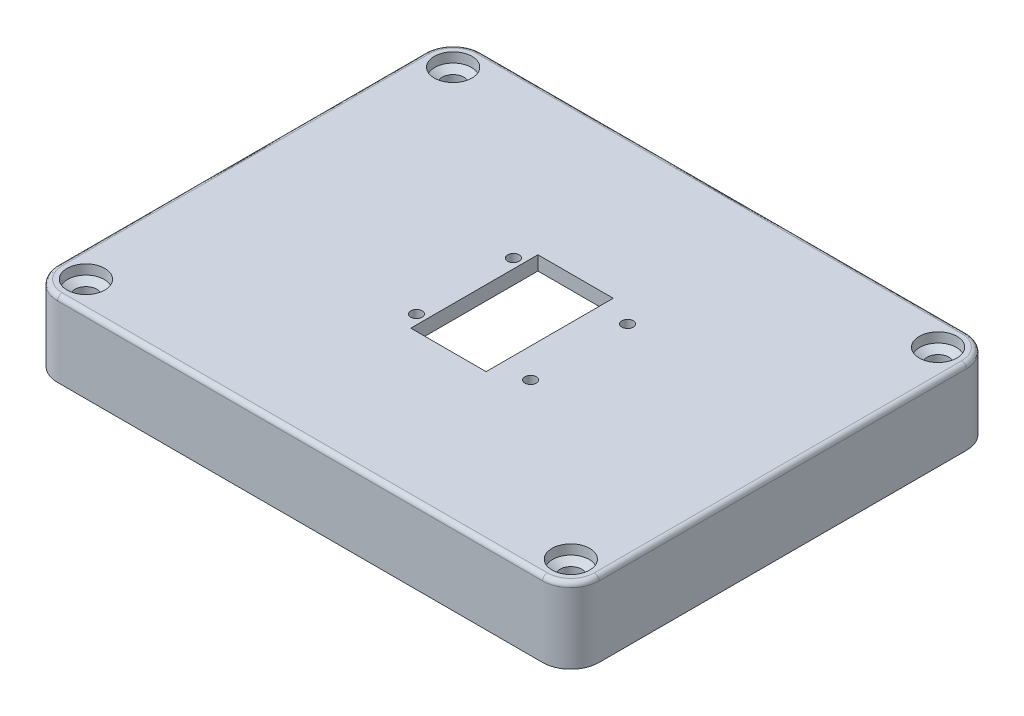
from build123d import *

# Parameters (mm, degrees)
CUTPROFILES_W             = 2
CUTPROFILES_H             = 3
SRQPVM_COPY_1_SKETCH_W    = 2
SRQPVM_COPY_1_SKETCH_H    = 3
CBFASTENINGHOLEBOTTOMS_R  = 2.2
CBFASTENINGHOLETOPS_R     = 2.35
CORNERBODYPOCKETCUT_DEPTH = 13
CORNERBODYSIDEHOLES_R     = 1
CORNERBODYSIDEHOLE_DEPTH  = 12
CBPCVM_COPY_1_DEPTH       = 13
CBPCVM_COPY_2_SKETCH_R    = 1
CBPCVM_COPY_2_DEPTH       = 12
TOPBODYFILLET_R           = 1
SCHIZZO1_R                = 1.2
SCHIZZO1_W                = 16
SCHIZZO1_H                = 27
TAGLIO_ESTRUSIONE1_DEPTH  = 10


# Read off the part's stored shape, not the designer's step: CBHM, CBFHHM
with BuildPart() as part:
    # BottomBaseS for Body → Body section 0
    with BuildSketch(Plane(origin=(0, -16, 0), x_dir=(1, 0, 0), z_dir=(0, 1, 0))):
        with BuildLine():
            Line((-51.5, 45), (51.5, 45))
            # circular arc as an exact rational Bezier (weights 1, cos(half-angle), 1)
            Bezier((51.5, 45), (57.5, 45), (57.5, 39), weights=[1, 0.707106781, 1])
            Line((57.5, 39), (57.5, -39))
            Bezier((57.5, -39), (57.5, -45), (51.5, -45), weights=[1, 0.707106781, 1])
            Line((51.5, -45), (-51.5, -45))
            Bezier((-51.5, -45), (-57.5, -45), (-57.5, -39), weights=[1, 0.707106781, 1])
            Line((-57.5, -39), (-57.5, 39))
            Bezier((-57.5, 39), (-57.5, 45), (-51.5, 45), weights=[1, 0.707106781, 1])
        make_face()
    # TopBaseS for Body → Body section 1
    with BuildSketch(Plane(origin=(0, 0, 0), x_dir=(1, 0, 0), z_dir=(0, 1, 0))):
        with BuildLine():
            Line((-51.5, -45), (51.5, -45))
            Bezier((51.5, -45), (57.5, -45), (57.5, -39), weights=[1, 0.707106781, 1])
            Line((57.5, -39), (57.5, 39))
            Bezier((57.5, 39), (57.5, 45), (51.5, 45), weights=[1, 0.707106781, 1])
            Line((51.5, 45), (-51.5, 45))
            Bezier((-51.5, 45), (-57.5, 45), (-57.5, 39), weights=[1, 0.707106781, 1])
            Line((-57.5, 39), (-57.5, -39))
            Bezier((-57.5, -39), (-57.5, -45), (-51.5, -45), weights=[1, 0.707106781, 1])
        make_face()
    loft()

    # ShellCutBottomS for ShellCut → ShellCut section 0
    with BuildSketch(Plane(origin=(0, -16, 0), x_dir=(1, 0, 0), z_dir=(0, 1, 0))):
        with BuildLine():
            Line((-51.5, 40), (51.5, 40))
            Bezier((51.5, 40), (52.5, 40), (52.5, 39), weights=[1, 0.707106781, 1])
            Line((52.5, 39), (52.5, -39))
            Bezier((52.5, -39), (52.5, -40), (51.5, -40), weights=[1, 0.707106781, 1])
            Line((51.5, -40), (-51.5, -40))
            Bezier((-51.5, -40), (-52.5, -40), (-52.5, -39), weights=[1, 0.707106781, 1])
            Line((-52.5, -39), (-52.5, 39))
            Bezier((-52.5, 39), (-52.5, 40), (-51.5, 40), weights=[1, 0.707106781, 1])
        make_face()
    # ShellCutTopS for ShellCut → ShellCut section 1
    with BuildSketch(Plane(origin=(0, -3, 0), x_dir=(1, 0, 0), z_dir=(0, 1, 0))):
        with BuildLine():
            Line((51.5, 40), (-51.5, 40))
            Bezier((-51.5, 40), (-52.5, 40), (-52.5, 39), weights=[1, 0.707106781, 1])
            Line((-52.5, 39), (-52.5, -39))
            Bezier((-52.5, -39), (-52.5, -40), (-51.5, -40), weights=[1, 0.707106781, 1])
            Line((-51.5, -40), (51.5, -40))
            Bezier((51.5, -40), (52.5, -40), (52.5, -39), weights=[1, 0.707106781, 1])
            Line((52.5, -39), (52.5, 39))
            Bezier((52.5, 39), (52.5, 40), (51.5, 40), weights=[1, 0.707106781, 1])
        make_face()
    loft(mode=Mode.SUBTRACT)

    # CornerBodyBottomS for CornerBody → CornerBody section 0
    with BuildSketch(Plane(origin=(0, -3, 0), x_dir=(-1, 0, 0), z_dir=(0, -1, 0))):
        with BuildLine():
            Line((42, 40), (51.5, 40))
            Bezier((51.5, 40), (52.5, 40), (52.5, 39), weights=[1, 0.707106781, 1])
            Line((52.5, 39), (52.5, 20.5))
            Bezier((52.5, 20.5), (52.5, 21), (52, 21), weights=[1, 0.707106781, 1])
            Line((52, 21), (50.5, 21))
            Bezier((50.5, 21), (42.5, 21), (42.5, 29), weights=[1, 0.707106781, 1])
            Line((42.5, 29), (42.5, 39.5))
            Bezier((42.5, 39.5), (42.5, 40), (42, 40), weights=[1, 0.707106781, 1])
        make_face()
    # CornerBodyTopS for CornerBody → CornerBody section 1
    with BuildSketch(Plane(origin=(0, -16, 0), x_dir=(1, 0, 0), z_dir=(0, 1, 0))):
        with BuildLine():
            Line((-52.5, 20.5), (-52.5, 39))
            Bezier((-52.5, 39), (-52.5, 40), (-51.5, 40), weights=[1, 0.707106781, 1])
            Line((-51.5, 40), (-42, 40))
            Bezier((-42, 40), (-42.5, 40), (-42.5, 39.5), weights=[1, 0.707106781, 1])
            Line((-42.5, 39.5), (-42.5, 29))
            Bezier((-42.5, 29), (-42.5, 21), (-50.5, 21), weights=[1, 0.707106781, 1])
            Line((-50.5, 21), (-52, 21))
            Bezier((-52, 21), (-52.5, 21), (-52.5, 20.5), weights=[1, 0.707106781, 1])
        make_face()
    cornerbody = loft()

    # CBVM: CornerBody across plane
    add(cornerbody.mirror(Plane(origin=(0, 0, 0), x_dir=(0, 0, 1), z_dir=(1, 0, 0))))

    # CBHM: part across plane


with BuildPart() as part_1:
    add(part.part)
    add(part.part.mirror(Plane.XY))

    # SealingRingQuarterPath: sweep along a path in SealingRingQuarterPathS
    with BuildLine(Plane.XZ.offset(16)) as sealingringquarterpath_path:
        Line((0, -42.5), (-42.000000004, -42.5))
        ThreePointArc((-42.000000004, -42.5), (-44.121320345, -41.621320342), (-45, -39.5))
        Line((-45, -39.5), (-45, -29))
        ThreePointArc((-45, -29), (-46.610912703, -25.110912703), (-50.5, -23.5))
        Line((-50.5, -23.5), (-52, -23.5))
        ThreePointArc((-52, -23.5), (-54.121320344, -22.621320344), (-55, -20.5))
        Line((-55, -20.5), (-55, 0))
    # CutProfileS → SealingRingQuarterPath (sweep, cut)
    with BuildSketch(Plane.XY):
        with Locations((-55, -14.5)):
            Rectangle(CUTPROFILES_W, CUTPROFILES_H)
    sealingringquarterpath = sweep(path=sealingringquarterpath_path.line, mode=Mode.SUBTRACT)

    # SRQPHM: SealingRingQuarterPath across plane
    add(sealingringquarterpath.mirror(Plane(origin=(0, 0, 0), x_dir=(0, 0, 1), z_dir=(1, 0, 0))), mode=Mode.SUBTRACT)

    # SRQPVM: SealingRingQuarterPath across plane
    add(sealingringquarterpath.mirror(Plane.XY), mode=Mode.SUBTRACT)

    # SRQPVM copy 1: sweep along a path in SRQPVM copy 1 path
    with BuildLine(Plane(origin=(0, -16, 0), x_dir=(-1, 0, 0), z_dir=(0, -1, 0))) as srqpvm_copy_1_path:
        Line((0, -42.5), (-42.000000004, -42.5))
        ThreePointArc((-42.000000004, -42.5), (-44.121320345, -41.621320342), (-45, -39.5))
        Line((-45, -39.5), (-45, -29))
        ThreePointArc((-45, -29), (-46.610912703, -25.110912703), (-50.5, -23.5))
        Line((-50.5, -23.5), (-52, -23.5))
        ThreePointArc((-52, -23.5), (-54.121320344, -22.621320344), (-55, -20.5))
        Line((-55, -20.5), (-55, 0))
    # SRQPVM copy 1 sketch → SRQPVM copy 1 (sweep, cut)
    with BuildSketch(Plane(origin=(0, 0, 0), x_dir=(-1, 0, 0), z_dir=(0, 0, -1))):
        with Locations((-55, -14.5)):
            Rectangle(SRQPVM_COPY_1_SKETCH_W, SRQPVM_COPY_1_SKETCH_H)
    sweep(path=srqpvm_copy_1_path.line, mode=Mode.SUBTRACT)

    # CBFasteningHoleBottomS → CornerBodyFasteningHole section 0
    with BuildSketch(Plane.XZ.offset(16)):
        with Locations((-51.5, -39)):
            Circle(CBFASTENINGHOLEBOTTOMS_R)
    # CBFasteningHoleTopS → CornerBodyFasteningHole section 1
    with BuildSketch(Plane(origin=(0, 0, 0), x_dir=(1, 0, 0), z_dir=(0, 1, 0))):
        with Locations((-51.5, 39)):
            Circle(CBFASTENINGHOLETOPS_R)
    cornerbodyfasteninghole = loft(mode=Mode.SUBTRACT)

    # CounterSinkProfileS → CounterSinkProfile (revolve, cut)
    with BuildSketch(Plane(origin=(-51.5, 0, 0), x_dir=(0, 0, -1), z_dir=(1, 0, 0))):
        Polygon((39, 0), (43, 0), (42.9, -2), (41.321875, -3), (39, -3), align=None)
    countersinkprofile = revolve(axis=Axis((-51.5, -3, -39), (0, 1, 0)), mode=Mode.SUBTRACT)

    # CBFHVM: CornerBodyFasteningHole, CounterSinkProfile across plane
    add(cornerbodyfasteninghole.mirror(Plane(origin=(0, 0, 0), x_dir=(0, 0, 1), z_dir=(1, 0, 0))), mode=Mode.SUBTRACT)
    add(countersinkprofile.mirror(Plane(origin=(0, 0, 0), x_dir=(0, 0, 1), z_dir=(1, 0, 0))), mode=Mode.SUBTRACT)

    # CBFHHM outline → CBFHHM (revolve, cut)
    with BuildSketch(Plane(origin=(-51.5, 0, 39), x_dir=(1, 0, 0), z_dir=(0, 0, 1))):
        Polygon((4, 0), (0, 0), (0, -16), (2.2, -16), (2.321875, -3), (3.9, -2), align=None)
    revolve(axis=Axis((-51.5, 0, 39), (0, 1, 0)), mode=Mode.SUBTRACT)

    # CBFHHM 2 outline → CBFHHM 2 (revolve, cut)
    with BuildSketch(Plane(origin=(51.5, 0, 39), x_dir=(1, 0, 0), z_dir=(0, 0, 1))):
        Polygon((4, 0), (0, 0), (0, -16), (2.2, -16), (2.321875, -3), (3.9, -2), align=None)
    revolve(axis=Axis((51.5, 0, 39), (0, 1, 0)), mode=Mode.SUBTRACT)

    # CornerBodyPocketCutS → CornerBodyPocketCut (cut)
    with BuildSketch(Plane(origin=(0, -16, 0), x_dir=(1, 0, 0), z_dir=(0, 1, 0))):
        with BuildLine():
            Line((-56.1, 24.274917218), (-56.1, 36.2))
            ThreePointArc((-56.1, 36.2), (-56.027472113, 36.296152395), (-55.91509434, 36.252830189))
            ThreePointArc((-55.91509434, 36.252830189), (-51.912898308, 33.81641871), (-47.575471698, 35.588537321))
            ThreePointArc((-47.575471698, 35.588537321), (-47.46497979, 35.616599686), (-47.4, 35.52293227))
            Line((-47.4, 35.52293227), (-47.4, 29))
            ThreePointArc((-47.4, 29), (-48.307968978, 26.807968978), (-50.5, 25.9))
            Line((-50.5, 25.9), (-52, 25.9))
            ThreePointArc((-52, 25.9), (-54.138466186, 25.458524213), (-55.927272727, 24.206282359))
            ThreePointArc((-55.927272727, 24.206282359), (-56.036927447, 24.18198518), (-56.1, 24.274917218))
        make_face()
    cornerbodypocketcut = extrude(amount=CORNERBODYPOCKETCUT_DEPTH, mode=Mode.SUBTRACT)

    # CornerBodySideHoleS → CornerBodySideHole (cut)
    with BuildSketch(Plane(origin=(0, -16, 0), x_dir=(1, 0, 0), z_dir=(0, 1, 0))):
        with Locations(Location((-46.5, 43, 0), (0, 0, 270))):
            Circle(CORNERBODYSIDEHOLES_R)
    cornerbodysidehole = extrude(amount=CORNERBODYSIDEHOLE_DEPTH, mode=Mode.SUBTRACT)

    # CBPCHM: CornerBodyPocketCut, CornerBodySideHole across plane
    add(cornerbodypocketcut.mirror(Plane(origin=(0, 0, 0), x_dir=(0, 0, 1), z_dir=(1, 0, 0))), mode=Mode.SUBTRACT)
    add(cornerbodysidehole.mirror(Plane(origin=(0, 0, 0), x_dir=(0, 0, 1), z_dir=(1, 0, 0))), mode=Mode.SUBTRACT)

    # CBPCVM: CornerBodyPocketCut, CornerBodySideHole across plane
    add(cornerbodypocketcut.mirror(Plane.XY), mode=Mode.SUBTRACT)
    add(cornerbodysidehole.mirror(Plane.XY), mode=Mode.SUBTRACT)

    # CBPCVM copy 1 sketch → CBPCVM copy 1 (cut)
    with BuildSketch(Plane(origin=(0, -16, 0), x_dir=(-1, 0, 0), z_dir=(0, 1, 0))):
        with BuildLine():
            Line((-56.1, 24.274917218), (-56.1, 36.2))
            ThreePointArc((-56.1, 36.2), (-56.027472113, 36.296152395), (-55.91509434, 36.252830189))
            ThreePointArc((-55.91509434, 36.252830189), (-51.912898308, 33.81641871), (-47.575471698, 35.588537321))
            ThreePointArc((-47.575471698, 35.588537321), (-47.46497979, 35.616599686), (-47.4, 35.52293227))
            Line((-47.4, 35.52293227), (-47.4, 29))
            ThreePointArc((-47.4, 29), (-48.307968978, 26.807968978), (-50.5, 25.9))
            Line((-50.5, 25.9), (-52, 25.9))
            ThreePointArc((-52, 25.9), (-54.138466186, 25.458524213), (-55.927272727, 24.206282359))
            ThreePointArc((-55.927272727, 24.206282359), (-56.036927447, 24.18198518), (-56.1, 24.274917218))
        make_face()
    extrude(amount=CBPCVM_COPY_1_DEPTH, mode=Mode.SUBTRACT)

    # CBPCVM copy 2 sketch → CBPCVM copy 2 (cut)
    with BuildSketch(Plane(origin=(0, -16, 0), x_dir=(-1, 0, 0), z_dir=(0, 1, 0))):
        with Locations(Location((-46.5, 43, 0), (0, 0, 270))):
            Circle(CBPCVM_COPY_2_SKETCH_R)
    extrude(amount=CBPCVM_COPY_2_DEPTH, mode=Mode.SUBTRACT)

    # TopBodyFillet
    topbodyfillet_edges = [part_1.edges().sort_by_distance(p)[0] for p in [
        (0, 0, 45),
        (-57.5, 0, 0),
        (0, 0, -45),
        (57.5, 0, 0),
    ]]
    fillet(topbodyfillet_edges, radius=TOPBODYFILLET_R)

    # Schizzo1 → Taglio-Estrusione1 (cut)
    with BuildSketch(Plane(origin=(0, 0, 0), x_dir=(1, 0, 0), z_dir=(0, 1, 0))):
        with Locations(Location((-10, -10.3, 0), (0, 0, 270))):
            Circle(SCHIZZO1_R)
        with Locations(Location((14.25, -10.3, 0), (0, 0, 270))):
            Circle(SCHIZZO1_R)
        with Locations(Location((-10, 10.3, 0), (0, 0, 270))):
            Circle(SCHIZZO1_R)
        with Locations(Location((14.25, 10.3, 0), (0, 0, 270))):
            Circle(SCHIZZO1_R)
        Rectangle(SCHIZZO1_W, SCHIZZO1_H)
    extrude(amount=-TAGLIO_ESTRUSIONE1_DEPTH, mode=Mode.SUBTRACT)


solid = part_1.part
